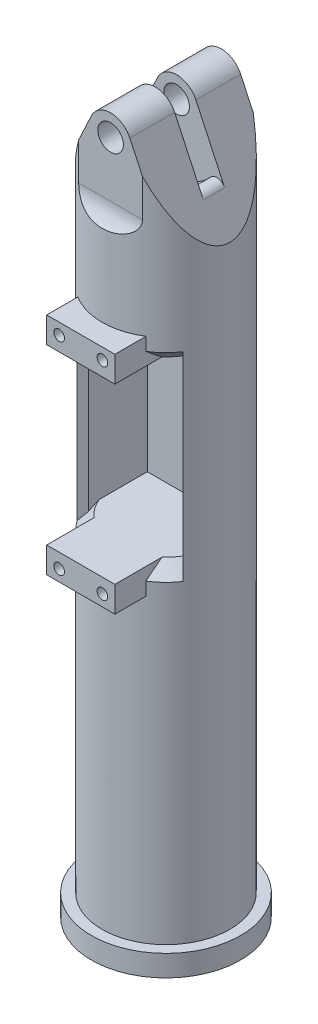
from build123d import *

# Parameters (mm, degrees)
SKETCH1_R               = 15
BOSS_EXTRUDE1_DEPTH     = 170
CUT_EXTRUDE1_DEPTH      = 2.5
CUT_EXTRUDE2_DEPTH      = 172.31841699
CUT_EXTRUDE2_DEPTH_BACK = 172.31841699
SKETCH4_R               = 3
CUT_EXTRUDE3_DEPTH      = 173.942186995
CUT_EXTRUDE4_DEPTH      = 173.942186995
FILLET1_R               = 2
SKETCH6_W               = 16
SKETCH6_H               = 52.83
BOSS_EXTRUDE2_DEPTH     = 20
SKETCH7_W               = 22.170562286
SKETCH7_H               = 40.7
CUT_EXTRUDE5_DEPTH      = 26.7
SKETCH8_R               = 1.25
CUT_EXTRUDE6_DEPTH      = 6
SKETCH9_R               = 17.5
BOSS_EXTRUDE3_DEPTH     = 5
SKETCH10_R              = 1.5
CUT_EXTRUDE7_DEPTH      = 168.126449134
CHAMFER1_SIZE           = 3


with BuildPart() as part:
    # Sketch1 → Boss-Extrude1 (new body)
    with BuildSketch(Plane(origin=(0, 0, 0), x_dir=(1, 0, 0), z_dir=(0, 1, 0))):
        with Locations(Location((0, 0, 0), (0, 0, 270))):
            Circle(SKETCH1_R)
    extrude(amount=BOSS_EXTRUDE1_DEPTH)

    # Sketch2 → Cut-Extrude1 (cut, symmetric)
    with BuildSketch(Plane.XY):
        with BuildLine():
            Line((-10.5, 160), (-10.5, 182.220649026))
            Line((-10.5, 182.220649026), (10.5, 182.220649026))
            Line((10.5, 182.220649026), (10.5, 160))
            ThreePointArc((10.5, 160), (0, 149.5), (-10.5, 160))
        make_face()
    extrude(amount=CUT_EXTRUDE1_DEPTH, both=True, mode=Mode.SUBTRACT)

    # Sketch3 → Cut-Extrude2 (cut, two sides: drawn at the far end of the back side and taken through both)
    with BuildSketch(Plane(origin=(0, 0, 0), x_dir=(0, 0, -1), z_dir=(1, 0, 0)).offset(-CUT_EXTRUDE2_DEPTH_BACK)):
        with BuildLine():
            Line((-15, 170), (-13, 170))
            Line((-13, 170), (-13, 152))
            ThreePointArc((-13, 152), (-13.522774425, 149.550510257), (-15, 147.527864045))
            Line((-15, 147.527864045), (-15, 170))
        make_face()
        with BuildLine():
            Line((15, 170), (15, 147.527864045))
            ThreePointArc((15, 147.527864045), (13.522774425, 149.550510257), (13, 152))
            Line((13, 152), (13, 170))
            Line((13, 170), (15, 170))
        make_face()
    extrude(amount=CUT_EXTRUDE2_DEPTH + CUT_EXTRUDE2_DEPTH_BACK, mode=Mode.SUBTRACT)

    # Sketch4 → Cut-Extrude3 (cut, through all)
    with BuildSketch(Plane.XY.offset(13)):
        with Locations((0, 165)):
            Circle(SKETCH4_R)
    extrude(amount=-CUT_EXTRUDE3_DEPTH, mode=Mode.SUBTRACT)

    # Sketch5 → Cut-Extrude4 (cut, through all)
    with BuildSketch(Plane.XY.offset(13)):
        with BuildLine():
            Line((-4.531538935, 167.113091309), (-15, 144.663404108))
            Line((-15, 144.663404108), (-15, 175.276470842))
            Line((-15, 175.276470842), (15, 175.276470842))
            Line((15, 175.276470842), (15, 144.663404108))
            Line((15, 144.663404108), (4.531538935, 167.113091309))
            ThreePointArc((4.531538935, 167.113091309), (0, 170), (-4.531538935, 167.113091309))
        make_face()
    extrude(amount=-CUT_EXTRUDE4_DEPTH, mode=Mode.SUBTRACT)

    # Fillet1
    fillet1_edges = [part.edges().sort_by_distance(p)[0] for p in [
        (-9.710782673, 156.00616727, 0),
        (9.710782673, 156.00616727, 0),
    ]]
    fillet(fillet1_edges, radius=FILLET1_R)

    # Sketch6 → Boss-Extrude2 (add)
    with BuildSketch(Plane.XY):
        with Locations((0, 102)):
            Rectangle(SKETCH6_W, SKETCH6_H)
    extrude(amount=BOSS_EXTRUDE2_DEPTH)

    # Sketch7 → Cut-Extrude5 (cut)
    with BuildSketch(Plane.XY.offset(20)):
        with Locations((0, 102)):
            Rectangle(SKETCH7_W, SKETCH7_H)
    extrude(amount=-CUT_EXTRUDE5_DEPTH, mode=Mode.SUBTRACT)

    # Sketch8 → Cut-Extrude6 (cut)
    with BuildSketch(Plane.XY.offset(20)):
        with Locations((-5.08, 125.749)):
            Circle(SKETCH8_R)
        with Locations((-5.08, 78.251)):
            Circle(SKETCH8_R)
        with Locations((5.08, 125.749)):
            Circle(SKETCH8_R)
        with Locations((5.08, 78.251)):
            Circle(SKETCH8_R)
    extrude(amount=-CUT_EXTRUDE6_DEPTH, mode=Mode.SUBTRACT)

    # Sketch9 → Boss-Extrude3 (add)
    with BuildSketch(Plane.XZ):
        with Locations(Location((0, 0, 0), (0, 0, 270))):
            Circle(SKETCH9_R)
    extrude(amount=-BOSS_EXTRUDE3_DEPTH)

    # Sketch10 → Cut-Extrude7 (cut, through all)
    with BuildSketch(Plane(origin=(0, 5, 0), x_dir=(1, 0, 0), z_dir=(0, 1, 0))):
        with Locations(Location((0, 13, 0), (0, 0, 270))):
            Circle(SKETCH10_R)
        with Locations(Location((13, 0, 0), (0, 0, 270))):
            Circle(SKETCH10_R)
        with Locations(Location((0, -13, 0), (0, 0, 270))):
            Circle(SKETCH10_R)
        with Locations(Location((-13, 0, 0), (0, 0, 270))):
            Circle(SKETCH10_R)
    extrude(amount=-CUT_EXTRUDE7_DEPTH, mode=Mode.SUBTRACT)

    # Chamfer1
    # the kernel refuses this chamfer: 3, 2.123587696 mm, written as the material it takes off along each edge
    with BuildSketch(Plane(origin=(11.085281143, 122.35, 10.105272978), x_dir=(0.6193558356899025, 0, -0.785110405482479), z_dir=(0, -1, 0))) as chamfer1_piece_1:
        with BuildLine():
            Line((2.136042798, 0), (CHAMFER1_SIZE * 0.785110405482, -CHAMFER1_SIZE * 0.61935583569))
            Line((CHAMFER1_SIZE * 0.785110405482, -CHAMFER1_SIZE * 0.61935583569), (0, 0))
            ThreePointArc((0, 0), (1.060999102, 0.038068992), (2.136042798, 0))
        make_face()
    extrude(amount=40.7, mode=Mode.SUBTRACT)
    with BuildSketch(Plane(origin=(-11.085281143, 122.35, 10.105272978), x_dir=(-0.6193558356899055, 0, -0.7851104054824767), z_dir=(0, -1, 0))) as chamfer1_piece_2:
        with BuildLine():
            Line((2.136042798, 0), (CHAMFER1_SIZE * 0.785110405482, CHAMFER1_SIZE * 0.61935583569))
            Line((CHAMFER1_SIZE * 0.785110405482, CHAMFER1_SIZE * 0.61935583569), (0, 0))
            ThreePointArc((0, 0), (1.060999102, -0.038068992), (2.136042798, 0))
        make_face()
    extrude(amount=40.7, mode=Mode.SUBTRACT)
    with BuildSketch(Plane(origin=(0, 81.65, 0), x_dir=(0.9748295624413148, 0, 0.22295139423308089), z_dir=(0.22295139423308089, 0, -0.9748295624413148))) as chamfer1_piece_3_section:
        Polygon((15, CHAMFER1_SIZE), (15 - CHAMFER1_SIZE, 0), (15, 0), align=None)
    chamfer1_piece_3 = revolve(axis=Axis((0, 81.65, 0), (0, -1, 0)), revolution_arc=74.356268972, mode=Mode.PRIVATE)
    chamfer1_piece_3 = split(chamfer1_piece_3, bisect_by=Plane(origin=(8, 81.65, 0), z_dir=(1, 0, 0)), keep=Keep.TOP, mode=Mode.PRIVATE)
    chamfer1_piece_3 = split(chamfer1_piece_3, bisect_by=Plane(origin=(11.085281143, 81.65, 0), z_dir=(-1, 0, 0)), keep=Keep.TOP, mode=Mode.PRIVATE)
    add(chamfer1_piece_3, mode=Mode.SUBTRACT)
    with BuildSketch(Plane(origin=(0, 81.65, 0), x_dir=(-0.04817493211174053, 0, 0.9988389138975459), z_dir=(0.9988389138975459, 0, 0.04817493211174053))) as chamfer1_piece_4_section:
        Polygon((15, CHAMFER1_SIZE), (15 - CHAMFER1_SIZE, 0), (15, 0), align=None)
    chamfer1_piece_4 = revolve(axis=Axis((0, 81.65, 0), (0, -1, 0)), revolution_arc=74.356268972, mode=Mode.PRIVATE)
    chamfer1_piece_4 = split(chamfer1_piece_4, bisect_by=Plane(origin=(-8, 81.65, 0), z_dir=(-1, 0, 0)), keep=Keep.TOP, mode=Mode.PRIVATE)
    chamfer1_piece_4 = split(chamfer1_piece_4, bisect_by=Plane(origin=(-11.085281143, 81.65, 0), z_dir=(1, 0, 0)), keep=Keep.TOP, mode=Mode.PRIVATE)
    add(chamfer1_piece_4, mode=Mode.SUBTRACT)
    with BuildSketch(Plane(origin=(0, 122.35, 0), x_dir=(0.9748295624413144, 0, 0.22295139423308263), z_dir=(0.22295139423308263, 0, -0.9748295624413144))) as chamfer1_piece_5_section:
        Polygon((15, -CHAMFER1_SIZE), (15 - CHAMFER1_SIZE, 0), (15, 0), align=None)
    chamfer1_piece_5 = revolve(axis=Axis((0, 122.35, 0), (0, -1, 0)), revolution_arc=74.356268972, mode=Mode.PRIVATE)
    chamfer1_piece_5 = split(chamfer1_piece_5, bisect_by=Plane(origin=(8, 122.35, 0), z_dir=(1, 0, 0)), keep=Keep.TOP, mode=Mode.PRIVATE)
    chamfer1_piece_5 = split(chamfer1_piece_5, bisect_by=Plane(origin=(11.085281143, 122.35, 0), z_dir=(-1, 0, 0)), keep=Keep.TOP, mode=Mode.PRIVATE)
    add(chamfer1_piece_5, mode=Mode.SUBTRACT)
    with BuildSketch(Plane(origin=(0, 122.35, 0), x_dir=(-0.04817493211174064, 0, 0.9988389138975459), z_dir=(0.9988389138975459, 0, 0.04817493211174064))) as chamfer1_piece_6_section:
        Polygon((15, -CHAMFER1_SIZE), (15 - CHAMFER1_SIZE, 0), (15, 0), align=None)
    chamfer1_piece_6 = revolve(axis=Axis((0, 122.35, 0), (0, -1, 0)), revolution_arc=74.356268972, mode=Mode.PRIVATE)
    chamfer1_piece_6 = split(chamfer1_piece_6, bisect_by=Plane(origin=(-8, 122.35, 0), z_dir=(-1, 0, 0)), keep=Keep.TOP, mode=Mode.PRIVATE)
    chamfer1_piece_6 = split(chamfer1_piece_6, bisect_by=Plane(origin=(-11.085281143, 122.35, 0), z_dir=(1, 0, 0)), keep=Keep.TOP, mode=Mode.PRIVATE)
    add(chamfer1_piece_6, mode=Mode.SUBTRACT)
    with BuildSketch(Plane(origin=(0, 122.35, 0), x_dir=(0.9748295624413144, 0, 0.22295139423308263), z_dir=(0.22295139423308263, 0, -0.9748295624413144))) as chamfer1_piece_7a_section:
        Polygon((15, -CHAMFER1_SIZE), (15 - CHAMFER1_SIZE, 0), (15, 0), align=None)
    chamfer1_piece_7a = revolve(axis=Axis((0, 122.35, 0), (0, -1, 0)), revolution_arc=74.356268972, mode=Mode.PRIVATE)
    chamfer1_piece_7a = split(chamfer1_piece_7a, bisect_by=Plane(origin=(11.085281143, 122.35, 0), z_dir=(1, 0, 0)), keep=Keep.TOP, mode=Mode.PRIVATE)
    with BuildSketch(Plane(origin=(11.085281143, 130.065048964, 10.105272978), x_dir=(0.6193558356899025, 0, -0.785110405482479), z_dir=(0, -1, 0))) as chamfer1_piece_7b_section:
        with BuildLine():
            Line((2.136042798, 0), (CHAMFER1_SIZE * 0.785110405482, -CHAMFER1_SIZE * 0.61935583569))
            Line((CHAMFER1_SIZE * 0.785110405482, -CHAMFER1_SIZE * 0.61935583569), (0, 0))
            ThreePointArc((0, 0), (1.060999102, 0.038068992), (2.136042798, 0))
        make_face()
    chamfer1_piece_7b = extrude(amount=48.415048964, mode=Mode.PRIVATE)
    chamfer1_piece_7b = split(chamfer1_piece_7b, bisect_by=Plane(origin=(11.085281143, 122.35, 10.105272978), z_dir=(0, 1, 0)), keep=Keep.TOP, mode=Mode.PRIVATE)
    chamfer1_piece_7 = chamfer1_piece_7a & chamfer1_piece_7b
    add(chamfer1_piece_7, mode=Mode.SUBTRACT)
    with BuildSketch(Plane(origin=(11.085281143, 122.35, 10.105272978), x_dir=(0.6193558356899025, 0, -0.785110405482479), z_dir=(0, -1, 0))) as chamfer1_piece_8a_section:
        with BuildLine():
            Line((2.136042798, 0), (CHAMFER1_SIZE * 0.785110405482, -CHAMFER1_SIZE * 0.61935583569))
            Line((CHAMFER1_SIZE * 0.785110405482, -CHAMFER1_SIZE * 0.61935583569), (0, 0))
            ThreePointArc((0, 0), (1.060999102, 0.038068992), (2.136042798, 0))
        make_face()
    chamfer1_piece_8a = extrude(amount=48.415048964, mode=Mode.PRIVATE)
    chamfer1_piece_8a = split(chamfer1_piece_8a, bisect_by=Plane(origin=(11.085281143, 81.65, 10.105272978), z_dir=(0, -1, 0)), keep=Keep.TOP, mode=Mode.PRIVATE)
    with BuildSketch(Plane(origin=(0, 81.65, 0), x_dir=(0.9748295624413148, 0, 0.22295139423308089), z_dir=(0.22295139423308089, 0, -0.9748295624413148))) as chamfer1_piece_8b_section:
        Polygon((15, CHAMFER1_SIZE), (15 - CHAMFER1_SIZE, 0), (15, 0), align=None)
    chamfer1_piece_8b = revolve(axis=Axis((0, 81.65, 0), (0, -1, 0)), revolution_arc=74.356268972, mode=Mode.PRIVATE)
    chamfer1_piece_8b = split(chamfer1_piece_8b, bisect_by=Plane(origin=(11.085281143, 81.65, 0), z_dir=(1, 0, 0)), keep=Keep.TOP, mode=Mode.PRIVATE)
    chamfer1_piece_8 = chamfer1_piece_8a & chamfer1_piece_8b
    add(chamfer1_piece_8, mode=Mode.SUBTRACT)
    with BuildSketch(Plane(origin=(-11.085281143, 130.065048964, 10.105272978), x_dir=(-0.6193558356899055, 0, -0.7851104054824767), z_dir=(0, -1, 0))) as chamfer1_piece_9a_section:
        with BuildLine():
            Line((2.136042798, 0), (CHAMFER1_SIZE * 0.785110405482, CHAMFER1_SIZE * 0.61935583569))
            Line((CHAMFER1_SIZE * 0.785110405482, CHAMFER1_SIZE * 0.61935583569), (0, 0))
            ThreePointArc((0, 0), (1.060999102, -0.038068992), (2.136042798, 0))
        make_face()
    chamfer1_piece_9a = extrude(amount=48.415048964, mode=Mode.PRIVATE)
    chamfer1_piece_9a = split(chamfer1_piece_9a, bisect_by=Plane(origin=(-11.085281143, 122.35, 10.105272978), z_dir=(0, 1, 0)), keep=Keep.TOP, mode=Mode.PRIVATE)
    with BuildSketch(Plane(origin=(0, 122.35, 0), x_dir=(-0.04817493211174064, 0, 0.9988389138975459), z_dir=(0.9988389138975459, 0, 0.04817493211174064))) as chamfer1_piece_9b_section:
        Polygon((15, -CHAMFER1_SIZE), (15 - CHAMFER1_SIZE, 0), (15, 0), align=None)
    chamfer1_piece_9b = revolve(axis=Axis((0, 122.35, 0), (0, -1, 0)), revolution_arc=74.356268972, mode=Mode.PRIVATE)
    chamfer1_piece_9b = split(chamfer1_piece_9b, bisect_by=Plane(origin=(-11.085281143, 122.35, 0), z_dir=(-1, 0, 0)), keep=Keep.TOP, mode=Mode.PRIVATE)
    chamfer1_piece_9 = chamfer1_piece_9a & chamfer1_piece_9b
    add(chamfer1_piece_9, mode=Mode.SUBTRACT)
    with BuildSketch(Plane(origin=(0, 81.65, 0), x_dir=(-0.04817493211174053, 0, 0.9988389138975459), z_dir=(0.9988389138975459, 0, 0.04817493211174053))) as chamfer1_piece_10a_section:
        Polygon((15, CHAMFER1_SIZE), (15 - CHAMFER1_SIZE, 0), (15, 0), align=None)
    chamfer1_piece_10a = revolve(axis=Axis((0, 81.65, 0), (0, -1, 0)), revolution_arc=74.356268972, mode=Mode.PRIVATE)
    chamfer1_piece_10a = split(chamfer1_piece_10a, bisect_by=Plane(origin=(-11.085281143, 81.65, 0), z_dir=(-1, 0, 0)), keep=Keep.TOP, mode=Mode.PRIVATE)
    with BuildSketch(Plane(origin=(-11.085281143, 122.35, 10.105272978), x_dir=(-0.6193558356899055, 0, -0.7851104054824767), z_dir=(0, -1, 0))) as chamfer1_piece_10b_section:
        with BuildLine():
            Line((2.136042798, 0), (CHAMFER1_SIZE * 0.785110405482, CHAMFER1_SIZE * 0.61935583569))
            Line((CHAMFER1_SIZE * 0.785110405482, CHAMFER1_SIZE * 0.61935583569), (0, 0))
            ThreePointArc((0, 0), (1.060999102, -0.038068992), (2.136042798, 0))
        make_face()
    chamfer1_piece_10b = extrude(amount=48.415048964, mode=Mode.PRIVATE)
    chamfer1_piece_10b = split(chamfer1_piece_10b, bisect_by=Plane(origin=(-11.085281143, 81.65, 10.105272978), z_dir=(0, -1, 0)), keep=Keep.TOP, mode=Mode.PRIVATE)
    chamfer1_piece_10 = chamfer1_piece_10a & chamfer1_piece_10b
    add(chamfer1_piece_10, mode=Mode.SUBTRACT)


solid = part.part
